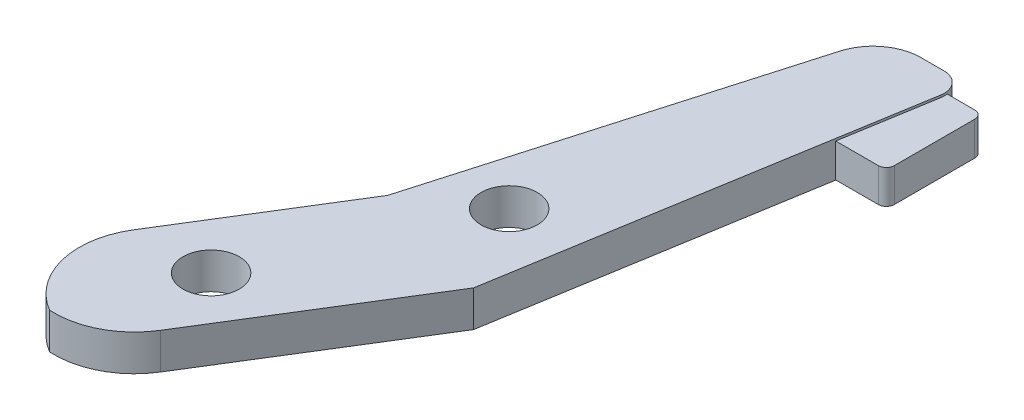
from build123d import *

# Parameters (mm, degrees)
BOSS_EXTRUDE1_DEPTH = 2.25
FILLET1_R           = 5
SKETCH2_R           = 1.75
CUT_EXTRUDE1_DEPTH  = 45.881363874
BOSS_EXTRUDE2_REACH = 39.627
SKETCH4_W           = 6
SKETCH4_H           = 2.1
SKETCH4_2_W         = 6
SKETCH4_2_H         = 2.1
BOSS_EXTRUDE3_DEPTH = 2.150401339
FILLET2_R           = 3
FILLET3_R           = 1.2
FILLET4_R           = 0.5


with BuildPart() as part:
    # Sketch1 → Boss-Extrude1 (new body)
    with BuildSketch(Plane(origin=(0, 0, 0), x_dir=(1, 0, 0), z_dir=(0, 1, 0))):
        Polygon((0, 0), (9.481214188, 15.300541739), (16.403607864, 39.323040897), (21.51680222, 39.323040897), (17.140904697, 12.99204844), (7.659690509, -2.308493299), align=None)
    extrude(amount=BOSS_EXTRUDE1_DEPTH)

    # Fillet1
    # the kernel refuses this fillet: 5 mm, written as the material it takes off along each edge
    with BuildSketch(Plane(origin=(7.659690509, -9.589301146, 2.308493299), x_dir=(0.5267341215597666, 0, -0.8500300966346198), z_dir=(0, 1, 0))) as fillet1_piece_1:
        with BuildLine():
            CenterArc((FILLET1_R * 0.767144091705, FILLET1_R), FILLET1_R, 195.013192562, 74.986807438)
            Line((-FILLET1_R * 0.19872211495, FILLET1_R * 0.740958553812), (0, 0))
            Line((0, 0), (FILLET1_R * 0.767144091705, 0))
        make_face()
    extrude(amount=21.428602293, mode=Mode.SUBTRACT)
    with BuildSketch(Plane(origin=(0, -16.294200966, 0), x_dir=(0.5267341215597675, 0, -0.8500300966346193), z_dir=(0, 1, 0))) as fillet1_piece_2:
        with BuildLine():
            CenterArc((FILLET1_R * 1.30353607727, -FILLET1_R), FILLET1_R, 90, 105.013192562)
            Line((FILLET1_R * 0.337669870614, -FILLET1_R * 1.25904144619), (0, 0))
            Line((0, 0), (FILLET1_R * 1.30353607727, 0))
        make_face()
    extrude(amount=34.838401932, mode=Mode.SUBTRACT)

    # Sketch2 → Cut-Extrude1 (cut, through all)
    with BuildSketch(Plane(origin=(0, 2.25, 0), x_dir=(1, 0, 0), z_dir=(0, 1, 0))):
        with Locations(Location((8.167211871, 5.629873064, 0), (0, 0, 270))):
            Circle(SKETCH2_R)
        with Locations(Location((13.979207558, 18.366462331, 0), (0, 0, 270))):
            Circle(SKETCH2_R)
    extrude(amount=-CUT_EXTRUDE1_DEPTH, mode=Mode.SUBTRACT)

    # Boss-Extrude2: up to this plane
    boss_extrude2_end = Plane(origin=(17.140904697, 2.25, -12.99204844), z_dir=(-0.9864703728289792, 0, -0.16393963380053925))
    # Sketch4 → Boss-Extrude2 (add, up to the surface)
    with BuildSketch(Plane(origin=(23.5, -1.484709168, -8.201879583), x_dir=(0, 0, -1), z_dir=(1, 0, 0)), mode=Mode.PRIVATE) as boss_extrude2_sk1:
        with Locations((27.115050996, 2.541926215)):
            Rectangle(SKETCH4_W, SKETCH4_H)
    boss_extrude2_tool1 = split(extrude(boss_extrude2_sk1.sketch, amount=-BOSS_EXTRUDE2_REACH, mode=Mode.PRIVATE), bisect_by=boss_extrude2_end, keep=Keep.BOTH, mode=Mode.PRIVATE)
    add(boss_extrude2_tool1.solids().sort_by_distance((23.5, 1.057217, -35.316931))[0])

    # Sketch4<2> → Boss-Extrude3 (add)
    with BuildSketch(Plane(origin=(23.5, -1.484709168, -8.201879583), x_dir=(0, 0, -1), z_dir=(1, 0, 0))):
        with Locations((27.115050996, 2.541926215)):
            Rectangle(SKETCH4_2_W, SKETCH4_2_H)
    extrude(amount=-BOSS_EXTRUDE3_DEPTH)

    # Fillet2
    fillet2_edges = [part.edges().sort_by_distance(p)[0] for p in [
        (16.403607864, 1.125, -39.323040897),
    ]]
    fillet(fillet2_edges, radius=FILLET2_R)

    # Fillet3
    # the kernel refuses this fillet: 1.2 mm, written as the material it takes off along each edge
    with BuildSketch(Plane(origin=(21.51680222, -3.539709856, -39.323040897), x_dir=(-1, 0, 0), z_dir=(0, 1, 0))) as fillet3_piece_1_section:
        with BuildLine():
            CenterArc((FILLET3_R * 1.17990328535, FILLET3_R), FILLET3_R, 170.564358813, 99.435641187)
            Line((FILLET3_R * 0.19343291252, FILLET3_R * 1.1639396338), (0, 0))
            Line((0, 0), (FILLET3_R * 1.17990328535, 0))
        make_face()
    fillet3_piece_1 = extrude(amount=9.329419712, mode=Mode.PRIVATE)
    fillet3_piece_1 = split(fillet3_piece_1, bisect_by=Plane(origin=(21.129198659, 0.007217047, -39.030141568), z_dir=(0, -1, 0)), keep=Keep.TOP, mode=Mode.PRIVATE)
    fillet3_piece_1 = split(fillet3_piece_1, bisect_by=Plane(origin=(21.129198659, -1.766246404, -38.316930579), z_dir=(0, 0, -1)), keep=Keep.TOP, mode=Mode.PRIVATE)
    add(fillet3_piece_1, mode=Mode.SUBTRACT)
    with BuildSketch(Plane(origin=(21.51680222, -3.539709856, -39.323040897), x_dir=(-1, 0, 0), z_dir=(0, 1, 0))) as fillet3_piece_2_section:
        with BuildLine():
            CenterArc((FILLET3_R * 1.17990328535, FILLET3_R), FILLET3_R, 170.564358813, 99.435641187)
            Line((FILLET3_R * 0.19343291252, FILLET3_R * 1.1639396338), (0, 0))
            Line((0, 0), (FILLET3_R * 1.17990328535, 0))
        make_face()
    fillet3_piece_2 = extrude(amount=9.329419712, mode=Mode.PRIVATE)
    fillet3_piece_2 = split(fillet3_piece_2, bisect_by=Plane(origin=(21.322056941, 0.007217047, -38.16671154), z_dir=(0, -1, 0)), keep=Keep.TOP, mode=Mode.PRIVATE)
    fillet3_piece_2 = split(fillet3_piece_2, bisect_by=Plane(origin=(21.322056941, -1.766246404, -38.316930579), z_dir=(0, 0, 1)), keep=Keep.TOP, mode=Mode.PRIVATE)
    add(fillet3_piece_2, mode=Mode.SUBTRACT)
    with BuildSketch(Plane(origin=(21.51680222, -3.539709856, -39.323040897), x_dir=(-1, 0, 0), z_dir=(0, 1, 0))) as fillet3_piece_3_section:
        with BuildLine():
            CenterArc((FILLET3_R * 1.17990328535, FILLET3_R), FILLET3_R, 170.564358813, 99.435641187)
            Line((FILLET3_R * 0.19343291252, FILLET3_R * 1.1639396338), (0, 0))
            Line((0, 0), (FILLET3_R * 1.17990328535, 0))
        make_face()
    fillet3_piece_3 = extrude(amount=9.329419712, mode=Mode.PRIVATE)
    fillet3_piece_3 = split(fillet3_piece_3, bisect_by=Plane(origin=(21.129198659, 2.107217047, -39.030141568), z_dir=(0, -1, 0)), keep=Keep.TOP, mode=Mode.PRIVATE)
    fillet3_piece_3 = split(fillet3_piece_3, bisect_by=Plane(origin=(21.129198659, 0.007217047, -39.030141568), z_dir=(0, 1, 0)), keep=Keep.TOP, mode=Mode.PRIVATE)
    fillet3_piece_3 = split(fillet3_piece_3, bisect_by=Plane(origin=(21.129198659, 1.057217047, -38.316930579), z_dir=(0, 0, -1)), keep=Keep.TOP, mode=Mode.PRIVATE)
    add(fillet3_piece_3, mode=Mode.SUBTRACT)
    with BuildSketch(Plane(origin=(21.51680222, -3.539709856, -39.323040897), x_dir=(-1, 0, 0), z_dir=(0, 1, 0))) as fillet3_piece_4_section:
        with BuildLine():
            CenterArc((FILLET3_R * 1.17990328535, FILLET3_R), FILLET3_R, 170.564358813, 99.435641187)
            Line((FILLET3_R * 0.19343291252, FILLET3_R * 1.1639396338), (0, 0))
            Line((0, 0), (FILLET3_R * 1.17990328535, 0))
        make_face()
    fillet3_piece_4 = extrude(amount=9.329419712, mode=Mode.PRIVATE)
    fillet3_piece_4 = split(fillet3_piece_4, bisect_by=Plane(origin=(21.129198659, 2.107217047, -39.030141568), z_dir=(0, 1, 0)), keep=Keep.TOP, mode=Mode.PRIVATE)
    fillet3_piece_4 = split(fillet3_piece_4, bisect_by=Plane(origin=(21.129198659, 3.948463452, -38.316930579), z_dir=(0, 0, -1)), keep=Keep.TOP, mode=Mode.PRIVATE)
    add(fillet3_piece_4, mode=Mode.SUBTRACT)
    with BuildSketch(Plane(origin=(21.51680222, -3.539709856, -39.323040897), x_dir=(-1, 0, 0), z_dir=(0, 1, 0))) as fillet3_piece_5_section:
        with BuildLine():
            CenterArc((FILLET3_R * 1.17990328535, FILLET3_R), FILLET3_R, 170.564358813, 99.435641187)
            Line((FILLET3_R * 0.19343291252, FILLET3_R * 1.1639396338), (0, 0))
            Line((0, 0), (FILLET3_R * 1.17990328535, 0))
        make_face()
    fillet3_piece_5 = extrude(amount=9.329419712, mode=Mode.PRIVATE)
    fillet3_piece_5 = split(fillet3_piece_5, bisect_by=Plane(origin=(21.322056941, 2.107217047, -38.16671154), z_dir=(0, 1, 0)), keep=Keep.TOP, mode=Mode.PRIVATE)
    fillet3_piece_5 = split(fillet3_piece_5, bisect_by=Plane(origin=(21.322056941, 3.948463452, -38.316930579), z_dir=(0, 0, 1)), keep=Keep.TOP, mode=Mode.PRIVATE)
    add(fillet3_piece_5, mode=Mode.SUBTRACT)

    # Fillet4
    fillet4_edges = [part.edges().sort_by_distance(p)[0] for p in [
        (23.5, 1.057217047, -38.316930579),
        (23.5, 1.057217047, -32.316930579),
    ]]
    fillet(fillet4_edges, radius=FILLET4_R)


solid = part.part
